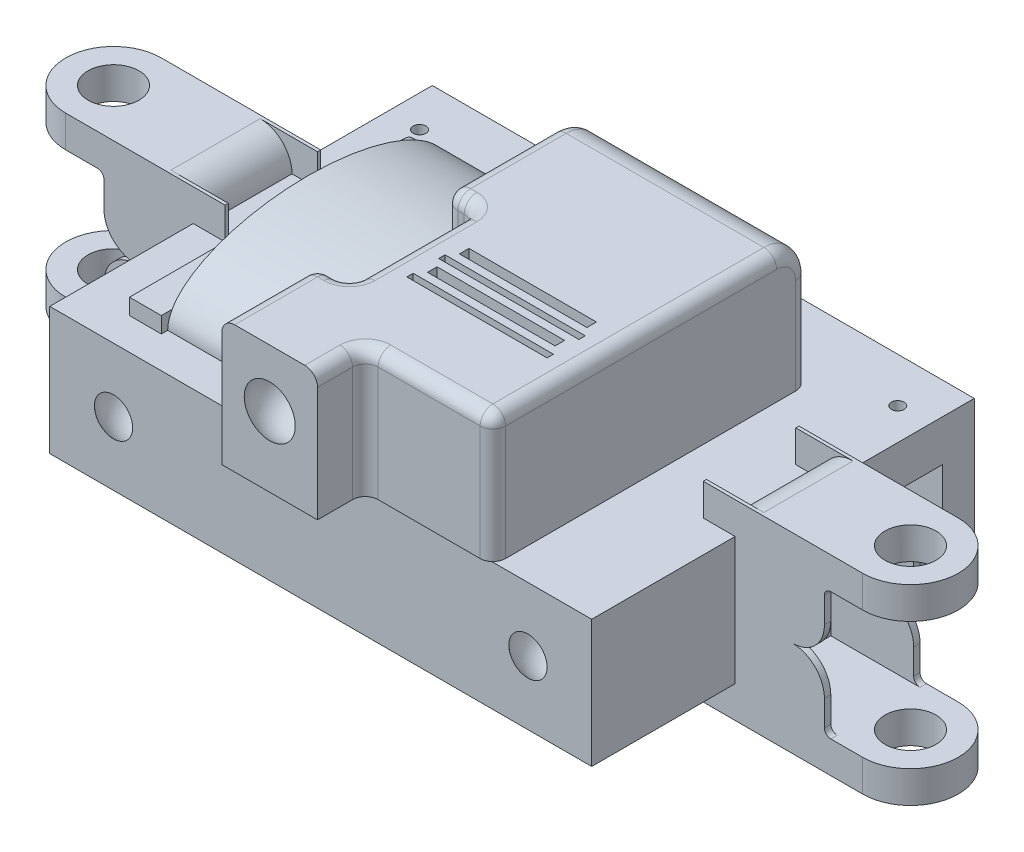
from build123d import *

# Parameters (mm, degrees)
SKETCH1_W                = 85
SKETCH1_H                = 60
BOSS_EXTRUDE1_DEPTH      = 20
BOSS_EXTRUDE4_DEPTH      = 5
SKETCH4_W                = 4
SKETCH4_H                = 14
CUT_EXTRUDE2_DEPTH       = 5
FILLET1_R                = 5
SKETCH5_W                = 14
SKETCH5_H                = 10
BOSS_EXTRUDE6_DEPTH      = 7.5
SKETCH7_W                = 12
SKETCH7_H                = 13
CUT_EXTRUDE5_DEPTH       = 10
SKETCH8_W                = 13
SKETCH8_H                = 10
CUT_EXTRUDE6_DEPTH       = 10
FILLET4_R                = 5
FILLET5_R                = 1
SKETCH9_R                = 4
CUT_EXTRUDE7_DEPTH       = 10
BOSS_EXTRUDE7_DEPTH      = 20
FILLET6_R                = 5
FILLET7_START            = 20
FILLET7_DEPTH            = 21
FILLET7_2_DEPTH          = 20
FILLET8_R                = 2
CIRPATTERN1_COUNT        = 2
FILLET1_OF_CIRPATTERN1_R = 5
FILLET4_OF_CIRPATTERN1_R = 5
FILLET5_OF_CIRPATTERN1_R = 1
CIRPATTERN5_START        = -7.5
CIRPATTERN5_DEPTH        = 1
CIRPATTERN5_START_2      = 6.5
CIRPATTERN5_2_DEPTH      = 1
CIRPATTERN5_START_3      = -5
CIRPATTERN5_3_OUTLINE_R  = 4
CIRPATTERN5_3_DEPTH      = 5
CIRPATTERN5_4_OUTLINE_W  = 1
CIRPATTERN5_4_OUTLINE_H  = 15
CIRPATTERN5_4_DEPTH      = 10
CIRPATTERN5_START_4      = -7
CIRPATTERN5_5_DEPTH      = 14
CIRPATTERN5_6_DEPTH      = 14
MIRROR1_START            = -7.5
MIRROR1_DEPTH            = 1
MIRROR1_START_2          = 6.5
MIRROR1_2_DEPTH          = 1
MIRROR1_START_3          = -5
MIRROR1_3_OUTLINE_R      = 4
MIRROR1_3_DEPTH          = 5
MIRROR1_4_OUTLINE_W      = 1
MIRROR1_4_OUTLINE_H      = 15
MIRROR1_4_DEPTH          = 10
MIRROR1_START_4          = -7
MIRROR1_5_DEPTH          = 14
MIRROR1_6_DEPTH          = 14
SKETCH16_W               = 22
SKETCH16_H               = 1
CUT_EXTRUDE9_DEPTH       = 5
BOSS_EXTRUDE8_DEPTH      = 20
BOSS_EXTRUDE9_DEPTH      = 5
SKETCH25_W               = 9
SKETCH25_H               = 7
CUT_EXTRUDE10_DEPTH      = 126.300638466
SKETCH11_W               = 20
SKETCH11_H               = 1.5
CUT_EXTRUDE8_DEPTH       = 20
SKETCH26_W               = 10
SKETCH26_H               = 9
CUT_EXTRUDE11_DEPTH      = 127.199247224
SKETCH30_R               = 1
CUT_EXTRUDE12_DEPTH      = 85.409715081


with BuildPart() as part:
    # Sketch1 → Boss-Extrude1 (new body)
    with BuildSketch(Plane(origin=(0, 0, 0), x_dir=(1, 0, 0), z_dir=(0, 1, 0))):
        Rectangle(SKETCH1_W, SKETCH1_H)
    extrude(amount=BOSS_EXTRUDE1_DEPTH)

    # Sketch2 → Boss-Extrude4 (add)
    with BuildSketch(Plane(origin=(0, 20, 0), x_dir=(1, 0, 0), z_dir=(0, 1, 0))):
        with BuildLine():
            Line((-37.5, 7.5), (-62.5, 7.5))
            ThreePointArc((-62.5, 7.5), (-70, 0), (-62.5, -7.5))
            Line((-62.5, -7.5), (-37.5, -7.5))
            Line((-37.5, -7.5), (-37.5, 7.5))
        make_face()
    boss_extrude4 = extrude(amount=BOSS_EXTRUDE4_DEPTH)

    # Sketch4 → Cut-Extrude2 (cut)
    with BuildSketch(Plane(origin=(0, 25, 0), x_dir=(1, 0, 0), z_dir=(0, 1, 0))):
        with Locations((-39.5, 0)):
            Rectangle(SKETCH4_W, SKETCH4_H)
    cut_extrude2 = extrude(amount=-CUT_EXTRUDE2_DEPTH, mode=Mode.SUBTRACT)

    # Fillet1
    fillet1_edges = [part.edges().sort_by_distance(p)[0] for p in [
        (-41.5, 25, 0),
    ]]
    fillet(fillet1_edges, radius=FILLET1_R - 0.0001)  # a hair under: the kernel refuses the full size

    # Sketch5 → Boss-Extrude6 (add, symmetric)
    with BuildSketch(Plane.XY):
        with Locations((-49.5, 15)):
            Rectangle(SKETCH5_W, SKETCH5_H)
    boss_extrude6 = extrude(amount=BOSS_EXTRUDE6_DEPTH, both=True)

    # Sketch7 → Cut-Extrude5 (cut)
    with BuildSketch(Plane.XZ.offset(-10)):
        with Locations((-49.5, 0)):
            Rectangle(SKETCH7_W, SKETCH7_H)
    cut_extrude5 = extrude(amount=-CUT_EXTRUDE5_DEPTH, mode=Mode.SUBTRACT)

    # Sketch8 → Cut-Extrude6 (cut)
    with BuildSketch(Plane(origin=(-55.5, 0, 0), x_dir=(0, 0, -1), z_dir=(1, 0, 0))):
        with Locations((0, 15)):
            Rectangle(SKETCH8_W, SKETCH8_H)
    cut_extrude6 = extrude(amount=-CUT_EXTRUDE6_DEPTH, mode=Mode.SUBTRACT)

    # Fillet4
    fillet4_edges = [part.edges().sort_by_distance(p)[0] for p in [
        (-56.5, 10, -7),
        (-56.5, 10, 7),
    ]]
    fillet(fillet4_edges, radius=FILLET4_R)

    # Fillet5
    fillet5_edges = [part.edges().sort_by_distance(p)[0] for p in [
        (-56.5, 20, -7),
        (-56.5, 20, 7),
    ]]
    fillet(fillet5_edges, radius=FILLET5_R)

    # Sketch9 → Cut-Extrude7 (cut)
    with BuildSketch(Plane(origin=(0, 25, 0), x_dir=(1, 0, 0), z_dir=(0, 1, 0))):
        with Locations(Location((-62.5, 0, 0), (0, 0, 270))):
            Circle(SKETCH9_R)
    cut_extrude7 = extrude(amount=-CUT_EXTRUDE7_DEPTH, mode=Mode.SUBTRACT)

    # Sketch10 → Boss-Extrude7 (add)
    with BuildSketch(Plane(origin=(0, 20, 0), x_dir=(1, 0, 0), z_dir=(0, 1, 0))):
        Polygon((-7.5, -3), (-2.5, -3), (-2.5, -23), (-7.5, -23), (-7.5, -38), (7.5, -38), (7.5, -30.5), (27.5, -30.5), (27.5, 0.746164075), (27.5, 19), (-7.5, 19), align=None)
    extrude(amount=BOSS_EXTRUDE7_DEPTH)

    # Fillet6
    fillet6_edges = [part.edges().sort_by_distance(p)[0] for p in [
        (10, 40, -19),
    ]]
    fillet(fillet6_edges, radius=FILLET6_R)

    # Fillet7: read off the stored shape, not the designer's step
    # Fillet7 outline → Fillet7 (cut)
    with BuildSketch(Plane(origin=(0, 0, 0), x_dir=(1, 0, 0), z_dir=(0, 1, 0)).offset(FILLET7_START)):
        with BuildLine():
            Line((27.5, -30.5), (27.5, -28.5))
            ThreePointArc((27.5, -28.5), (26.914213562, -29.914213562), (25.5, -30.5))
            Line((25.5, -30.5), (27.5, -30.5))
        make_face()
        with BuildLine():
            Line((-7.5, -23), (-7.5, -25))
            ThreePointArc((-7.5, -25), (-6.914213562, -23.585786438), (-5.5, -23))
            Line((-5.5, -23), (-7.5, -23))
        make_face()
        with BuildLine():
            Line((-7.5, -3), (-5.5, -3))
            ThreePointArc((-5.5, -3), (-6.914213562, -2.414213562), (-7.5, -1))
            Line((-7.5, -1), (-7.5, -3))
        make_face()
    extrude(amount=FILLET7_DEPTH, mode=Mode.SUBTRACT)

    # Fillet7 2 outline → Fillet7 2 (add)
    with BuildSketch(Plane(origin=(0, 0, 0), x_dir=(1, 0, 0), z_dir=(0, 1, 0)).offset(FILLET7_START)):
        with BuildLine():
            ThreePointArc((7.5, -32.5), (8.085786438, -31.085786438), (9.5, -30.5))
            Line((9.5, -30.5), (7.5, -30.5))
            Line((7.5, -30.5), (7.5, -32.5))
        make_face()
        with BuildLine():
            ThreePointArc((-4.5, -3), (-3.085786438, -3.585786438), (-2.5, -5))
            Line((-2.5, -5), (-2.5, -3))
            Line((-2.5, -3), (-4.5, -3))
        make_face()
        with BuildLine():
            ThreePointArc((-2.5, -21), (-3.085786438, -22.414213562), (-4.5, -23))
            Line((-4.5, -23), (-2.5, -23))
            Line((-2.5, -23), (-2.5, -21))
        make_face()
    extrude(amount=FILLET7_2_DEPTH)

    # Fillet8
    fillet8_edges = [part.edges().sort_by_distance(p)[0] for p in [
        (7.5, 40, 35.25),
        (-7.5, 40, -6.5),
        (-7.5, 27.5, -19),
        (-7.5, 38.535533906, -17.535533906),
        (27.5, 27.5, -19),
        (27.5, 38.535533906, -17.535533906),
        (27.5, 40, 7.25),
        (17.5, 40, 30.5),
        (-5, 40, 3),
        (-2.5, 40, 13),
        (-5, 40, 23),
        (-7.5, 40, 31.5),
        (-6.914213562, 40, 2.414213562),
        (-6.914213562, 40, 23.585786438),
        (26.914213562, 40, 29.914213562),
        (8.085786438, 40, 31.085786438),
        (-3.085786438, 40, 22.414213562),
        (-3.085786438, 40, 3.585786438),
    ]]
    fillet(fillet8_edges, radius=FILLET8_R)

    # CirPattern1: Boss-Extrude4, Cut-Extrude2, Boss-Extrude6, Cut-Extrude5, Cut-Extrude6, Cut-Extrude7 ×2 about axis
    cirpattern1_axis = Axis((0, 0, 0), (0, 1, 0))
    add([boss_extrude4.rotate(cirpattern1_axis, i * 360 / CIRPATTERN1_COUNT) for i in range(1, CIRPATTERN1_COUNT)])
    add([cut_extrude2.rotate(cirpattern1_axis, i * 360 / CIRPATTERN1_COUNT) for i in range(1, CIRPATTERN1_COUNT)], mode=Mode.SUBTRACT)
    add([boss_extrude6.rotate(cirpattern1_axis, i * 360 / CIRPATTERN1_COUNT) for i in range(1, CIRPATTERN1_COUNT)])
    add([cut_extrude5.rotate(cirpattern1_axis, i * 360 / CIRPATTERN1_COUNT) for i in range(1, CIRPATTERN1_COUNT)], mode=Mode.SUBTRACT)
    add([cut_extrude6.rotate(cirpattern1_axis, i * 360 / CIRPATTERN1_COUNT) for i in range(1, CIRPATTERN1_COUNT)], mode=Mode.SUBTRACT)
    add([cut_extrude7.rotate(cirpattern1_axis, i * 360 / CIRPATTERN1_COUNT) for i in range(1, CIRPATTERN1_COUNT)], mode=Mode.SUBTRACT)

    # Fillet1 of CirPattern1
    fillet1_of_cirpattern1_edges = [part.edges().sort_by_distance(p)[0] for p in [
        (41.5, 25, 0),
    ]]
    fillet(fillet1_of_cirpattern1_edges, radius=FILLET1_OF_CIRPATTERN1_R - 0.0001)  # a hair under: the kernel refuses the full size

    # Fillet4 of CirPattern1
    fillet4_of_cirpattern1_edges = [part.edges().sort_by_distance(p)[0] for p in [
        (56.5, 10, 7),
        (56.5, 10, -7),
    ]]
    fillet(fillet4_of_cirpattern1_edges, radius=FILLET4_OF_CIRPATTERN1_R)

    # Fillet5 of CirPattern1
    fillet5_of_cirpattern1_edges = [part.edges().sort_by_distance(p)[0] for p in [
        (56.5, 20, 7),
        (56.5, 20, -7),
    ]]
    fillet(fillet5_of_cirpattern1_edges, radius=FILLET5_OF_CIRPATTERN1_R)

    # CirPattern5: read off the stored shape, not the designer's step
    # CirPattern5 outline → CirPattern5 (add)
    with BuildSketch(Plane.XY.offset(CIRPATTERN5_START)):
        with BuildLine():
            ThreePointArc((57.5, 0), (56.792893219, 0.292893219), (56.5, 1))
            Line((56.5, 1), (56.5, 5))
            ThreePointArc((56.5, 5), (55.035533906, 8.535533906), (51.5, 10))
            Line((51.5, 10), (43.5, 10))
            Line((43.5, 10), (43.5, 0))
            Line((43.5, 0), (57.5, 0))
        make_face()
    extrude(amount=CIRPATTERN5_DEPTH)

    # CirPattern5 2 outline → CirPattern5 2 (add)
    with BuildSketch(Plane.XY.offset(CIRPATTERN5_START_2)):
        with BuildLine():
            ThreePointArc((57.5, 0), (56.792893219, 0.292893219), (56.5, 1))
            Line((56.5, 1), (56.5, 5))
            ThreePointArc((56.5, 5), (55.035533906, 8.535533906), (51.5, 10))
            Line((51.5, 10), (43.5, 10))
            Line((43.5, 10), (43.5, 0))
            Line((43.5, 0), (57.5, 0))
        make_face()
    extrude(amount=CIRPATTERN5_2_DEPTH)

    # CirPattern5 3 outline → CirPattern5 3 (add)
    with BuildSketch(Plane(origin=(0, 0, 0), x_dir=(1, 0, 0), z_dir=(0, 1, 0)).offset(CIRPATTERN5_START_3)):
        with BuildLine():
            Line((37.5, 7.5), (37.5, 7))
            Line((37.5, 7), (42.5, 7))
            Line((42.5, 7), (42.5, -7))
            Line((42.5, -7), (37.5, -7))
            Line((37.5, -7), (37.5, -7.5))
            Line((37.5, -7.5), (62.5, -7.5))
            ThreePointArc((62.5, -7.5), (70, 0), (62.5, 7.5))
            Line((62.5, 7.5), (37.5, 7.5))
        make_face()
        with Locations((62.5, 0)):
            Circle(CIRPATTERN5_3_OUTLINE_R, mode=Mode.SUBTRACT)
    extrude(amount=CIRPATTERN5_3_DEPTH)

    # CirPattern5 4 outline → CirPattern5 4 (add)
    with BuildSketch(Plane(origin=(0, 0, 0), x_dir=(1, 0, 0), z_dir=(0, 1, 0))):
        with Locations((43, 0)):
            Rectangle(CIRPATTERN5_4_OUTLINE_W, CIRPATTERN5_4_OUTLINE_H)
    extrude(amount=CIRPATTERN5_4_DEPTH)

    # CirPattern5 5 outline → CirPattern5 5 (cut)
    with BuildSketch(Plane.XY.offset(CIRPATTERN5_START_4)):
        with BuildLine():
            Line((42.5, -5), (46.5, -5))
            ThreePointArc((46.5, -5), (44.263932023, -4.472135955), (42.5, -3))
            Line((42.5, -3), (42.5, -5))
        make_face()
    extrude(amount=CIRPATTERN5_5_DEPTH, mode=Mode.SUBTRACT)

    # CirPattern5 6 outline → CirPattern5 6 (add)
    with BuildSketch(Plane.XY.offset(CIRPATTERN5_START_4)):
        with BuildLine():
            ThreePointArc((41.5, 0), (41.75658351, -1.58113883), (42.5, -3))
            Line((42.5, -3), (42.5, 0))
            Line((42.5, 0), (41.5, 0))
        make_face()
    extrude(amount=CIRPATTERN5_6_DEPTH)

    # Mirror1: read off the stored shape, not the designer's step
    # Mirror1 outline → Mirror1 (add)
    with BuildSketch(Plane.XY.offset(MIRROR1_START)):
        with BuildLine():
            Line((-56.5, 5), (-56.5, 1))
            ThreePointArc((-56.5, 1), (-56.792893219, 0.292893219), (-57.5, 0))
            Line((-57.5, 0), (-43.5, 0))
            Line((-43.5, 0), (-43.5, 10))
            Line((-43.5, 10), (-51.5, 10))
            ThreePointArc((-51.5, 10), (-55.035533906, 8.535533906), (-56.5, 5))
        make_face()
    extrude(amount=MIRROR1_DEPTH)

    # Mirror1 2 outline → Mirror1 2 (add)
    with BuildSketch(Plane.XY.offset(MIRROR1_START_2)):
        with BuildLine():
            Line((-56.5, 5), (-56.5, 1))
            ThreePointArc((-56.5, 1), (-56.792893219, 0.292893219), (-57.5, 0))
            Line((-57.5, 0), (-43.5, 0))
            Line((-43.5, 0), (-43.5, 10))
            Line((-43.5, 10), (-51.5, 10))
            ThreePointArc((-51.5, 10), (-55.035533906, 8.535533906), (-56.5, 5))
        make_face()
    extrude(amount=MIRROR1_2_DEPTH)

    # Mirror1 3 outline → Mirror1 3 (add)
    with BuildSketch(Plane(origin=(0, 0, 0), x_dir=(1, 0, 0), z_dir=(0, 1, 0)).offset(MIRROR1_START_3)):
        with BuildLine():
            Line((-37.5, -7.5), (-37.5, -7))
            Line((-37.5, -7), (-42.5, -7))
            Line((-42.5, -7), (-42.5, 7))
            Line((-42.5, 7), (-37.5, 7))
            Line((-37.5, 7), (-37.5, 7.5))
            Line((-37.5, 7.5), (-62.5, 7.5))
            ThreePointArc((-62.5, 7.5), (-70, 0), (-62.5, -7.5))
            Line((-62.5, -7.5), (-37.5, -7.5))
        make_face()
        with Locations((-62.5, 0)):
            Circle(MIRROR1_3_OUTLINE_R, mode=Mode.SUBTRACT)
    extrude(amount=MIRROR1_3_DEPTH)

    # Mirror1 4 outline → Mirror1 4 (add)
    with BuildSketch(Plane(origin=(0, 0, 0), x_dir=(1, 0, 0), z_dir=(0, 1, 0))):
        with Locations((-43, 0)):
            Rectangle(MIRROR1_4_OUTLINE_W, MIRROR1_4_OUTLINE_H)
    extrude(amount=MIRROR1_4_DEPTH)

    # Mirror1 5 outline → Mirror1 5 (cut)
    with BuildSketch(Plane.XY.offset(MIRROR1_START_4)):
        with BuildLine():
            ThreePointArc((-42.5, -3), (-44.263932023, -4.472135955), (-46.5, -5))
            Line((-46.5, -5), (-42.5, -5))
            Line((-42.5, -5), (-42.5, -3))
        make_face()
    extrude(amount=MIRROR1_5_DEPTH, mode=Mode.SUBTRACT)

    # Mirror1 6 outline → Mirror1 6 (add)
    with BuildSketch(Plane.XY.offset(MIRROR1_START_4)):
        with BuildLine():
            Line((-42.5, 0), (-42.5, -3))
            ThreePointArc((-42.5, -3), (-41.75658351, -1.58113883), (-41.5, 0))
            Line((-41.5, 0), (-42.5, 0))
        make_face()
    extrude(amount=MIRROR1_6_DEPTH)

    # Sketch16 → Cut-Extrude9 (cut)
    with BuildSketch(Plane(origin=(0, 40, 0), x_dir=(1, 0, 0), z_dir=(0, 1, 0))):
        with Locations((12.5, -12.5)):
            Rectangle(SKETCH16_W, SKETCH16_H)
        with Locations((12.5, -17.5)):
            Rectangle(SKETCH16_W, SKETCH16_H)
    extrude(amount=-CUT_EXTRUDE9_DEPTH, mode=Mode.SUBTRACT)

    # Sketch17 → Boss-Extrude8 (add)
    with BuildSketch(Plane(origin=(-10, 0, 0), x_dir=(0, 0, -1), z_dir=(1, 0, 0))):
        with BuildLine():
            Line((20, 20), (-24, 20))
            add(Edge.make_bspline(
                [(20, 20), (20, 30), (-2, 30), (-24, 30), (-24, 20)],
                knots=[0, 0, 0, 1.570796327, 1.570796327, 3.141592654, 3.141592654, 3.141592654], degree=2, weights=[1, 0.707106781, 1, 0.707106781, 1]))
        make_face()
    extrude(amount=-BOSS_EXTRUDE8_DEPTH)

    # Sketch18 → Boss-Extrude9 (add)
    with BuildSketch(Plane.ZY.offset(30)):
        with BuildLine():
            Line((-18, 22.5), (25, 22.5))
            Line((25, 22.5), (25, 20))
            Line((25, 20), (-20, 20))
            Line((-20, 20), (-20, 20.5))
            ThreePointArc((-20, 20.5), (-19.414213562, 21.914213562), (-18, 22.5))
        make_face()
    extrude(amount=BOSS_EXTRUDE9_DEPTH)

    # Sketch19 → Cut-Revolve2 (revolve, cut)
    with BuildSketch(Plane.XY.offset(26)):
        with BuildLine():
            Line((-32.5, 15), (-32.5, 5))
            ThreePointArc((-32.5, 5), (-27.5, 10), (-32.5, 15))
        make_face()
    cut_revolve2 = revolve(axis=Axis((-32.5, 15, 26), (0, -1, 0)), mode=Mode.SUBTRACT)

    # Mirror3: Cut-Revolve2 across plane
    add(cut_revolve2.mirror(Plane(origin=(0, 0, 0), x_dir=(0, 0, 1), z_dir=(1, 0, 0))), mode=Mode.SUBTRACT)

    # Sketch25 → Cut-Extrude10 (cut, through all)
    with BuildSketch(Plane.ZY.offset(42.5)):
        with Locations((-20.5, 10)):
            Rectangle(SKETCH25_W, SKETCH25_H)
    extrude(amount=-CUT_EXTRUDE10_DEPTH, mode=Mode.SUBTRACT)

    # Sketch11 → Cut-Extrude8 (cut)
    with BuildSketch(Plane(origin=(0, 40, 0), x_dir=(1, 0, 0), z_dir=(0, 1, 0))):
        with Locations((12.5, -15)):
            Rectangle(SKETCH11_W, SKETCH11_H)
        with Locations((12.5, -10)):
            Rectangle(SKETCH11_W, SKETCH11_H)
    extrude(amount=-CUT_EXTRUDE8_DEPTH, mode=Mode.SUBTRACT)

    # Sketch26 → Cut-Extrude11 (cut, through all)
    with BuildSketch(Plane.ZY.offset(43.5)):
        with Locations((0, 8.5)):
            Rectangle(SKETCH26_W, SKETCH26_H)
    extrude(amount=-CUT_EXTRUDE11_DEPTH, mode=Mode.SUBTRACT)

    # Sketch29 → Cut-Revolve3 (revolve, cut)
    with BuildSketch(Plane.XY.offset(35)):
        with BuildLine():
            Line((0, 26), (0, 36))
            ThreePointArc((0, 36), (5, 31), (0, 26))
        make_face()
    revolve(axis=Axis((0, 36, 35), (0, -1, 0)), mode=Mode.SUBTRACT)

    # Sketch30 → Cut-Extrude12 (cut, through all)
    with BuildSketch(Plane(origin=(0, 20, 0), x_dir=(1, 0, 0), z_dir=(0, 1, 0))):
        with Locations(Location((-37.5, 23, 0), (0, 0, 270))):
            Circle(SKETCH30_R)
        with Locations(Location((37.5, 23, 0), (0, 0, 270))):
            Circle(SKETCH30_R)
    extrude(amount=-CUT_EXTRUDE12_DEPTH, mode=Mode.SUBTRACT)


solid = part.part
